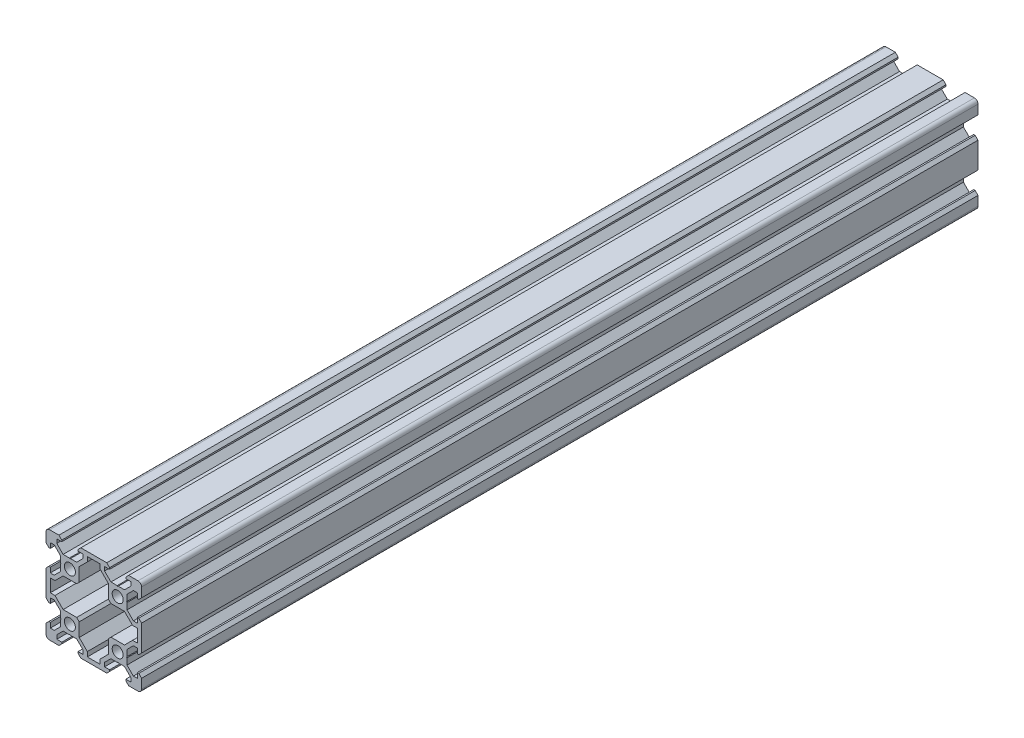
from build123d import *

# Parameters (mm, degrees)
SKETCH1_R           = 2.3
BOSS_EXTRUDE1_DEPTH = 350


with BuildPart() as part:
    # Sketch1 → Boss-Extrude1 (new body)
    with BuildSketch(Plane.XY):
        with BuildLine():
            Line((14.58, -20), (18.5, -20))
            ThreePointArc((18.5, -20), (19.560660172, -19.560660172), (20, -18.5))
            Line((20, -18.5), (20, -14.58))
            Line((20, -14.58), (18.815, -13.395))
            Line((18.815, -13.395), (18.2, -13.395))
            Line((18.2, -13.395), (18.2, -15.5))
            Line((18.2, -15.5), (16.560660172, -15.5))
            Line((16.560660172, -15.5), (13.9, -12.839339828))
            Line((13.9, -12.839339828), (13.9, -10.21))
            Line((13.9, -10.21), (13.69, -10))
            Line((13.69, -10), (13.9, -9.79))
            Line((13.9, -9.79), (13.9, -7.160660172))
            Line((13.9, -7.160660172), (16.560660172, -4.5))
            Line((16.560660172, -4.5), (18.2, -4.5))
            Line((18.2, -4.5), (18.2, -6.605))
            Line((18.2, -6.605), (18.815, -6.605))
            Line((18.815, -6.605), (20, -5.42))
            Line((20, -5.42), (20, 5.42))
            Line((20, 5.42), (18.815, 6.605))
            Line((18.815, 6.605), (18.2, 6.605))
            Line((18.2, 6.605), (18.2, 4.5))
            Line((18.2, 4.5), (16.560660172, 4.5))
            Line((16.560660172, 4.5), (13.9, 7.160660172))
            Line((13.9, 7.160660172), (13.9, 9.79))
            Line((13.9, 9.79), (13.69, 10))
            Line((13.69, 10), (13.9, 10.21))
            Line((13.9, 10.21), (13.9, 12.839339828))
            Line((13.9, 12.839339828), (16.560660172, 15.5))
            Line((16.560660172, 15.5), (18.2, 15.5))
            Line((18.2, 15.5), (18.2, 13.395))
            Line((18.2, 13.395), (18.815, 13.395))
            Line((18.815, 13.395), (20, 14.58))
            Line((20, 14.58), (20, 18.5))
            ThreePointArc((20, 18.5), (19.560660172, 19.560660172), (18.5, 20))
            Line((18.5, 20), (14.58, 20))
            Line((14.58, 20), (13.395, 18.815))
            Line((13.395, 18.815), (13.395, 18.2))
            Line((13.395, 18.2), (15.5, 18.2))
            Line((15.5, 18.2), (15.5, 16.560660172))
            Line((15.5, 16.560660172), (12.839339828, 13.9))
            Line((12.839339828, 13.9), (10.21, 13.9))
            Line((10.21, 13.9), (10, 13.69))
            Line((10, 13.69), (9.79, 13.9))
            Line((9.79, 13.9), (7.160660172, 13.9))
            Line((7.160660172, 13.9), (4.5, 16.560660172))
            Line((4.5, 16.560660172), (4.5, 18.2))
            Line((4.5, 18.2), (6.605, 18.2))
            Line((6.605, 18.2), (6.605, 18.815))
            Line((6.605, 18.815), (5.42, 20))
            Line((5.42, 20), (-5.42, 20))
            Line((-5.42, 20), (-6.605, 18.815))
            Line((-6.605, 18.815), (-6.605, 18.2))
            Line((-6.605, 18.2), (-4.5, 18.2))
            Line((-4.5, 18.2), (-4.5, 16.560660172))
            Line((-4.5, 16.560660172), (-7.160660172, 13.9))
            Line((-7.160660172, 13.9), (-9.79, 13.9))
            Line((-9.79, 13.9), (-10, 13.69))
            Line((-10, 13.69), (-10.21, 13.9))
            Line((-10.21, 13.9), (-12.839339828, 13.9))
            Line((-12.839339828, 13.9), (-15.5, 16.560660172))
            Line((-15.5, 16.560660172), (-15.5, 18.2))
            Line((-15.5, 18.2), (-13.395, 18.2))
            Line((-13.395, 18.2), (-13.395, 18.815))
            Line((-13.395, 18.815), (-14.58, 20))
            Line((-14.58, 20), (-18.5, 20))
            ThreePointArc((-18.5, 20), (-19.560660172, 19.560660172), (-20, 18.5))
            Line((-20, 18.5), (-20, 14.58))
            Line((-20, 14.58), (-18.815, 13.395))
            Line((-18.815, 13.395), (-18.2, 13.395))
            Line((-18.2, 13.395), (-18.2, 15.5))
            Line((-18.2, 15.5), (-16.560660172, 15.5))
            Line((-16.560660172, 15.5), (-13.9, 12.839339828))
            Line((-13.9, 12.839339828), (-13.9, 10.21))
            Line((-13.9, 10.21), (-13.69, 10))
            Line((-13.69, 10), (-13.9, 9.79))
            Line((-13.9, 9.79), (-13.9, 7.160660172))
            Line((-13.9, 7.160660172), (-16.560660172, 4.5))
            Line((-16.560660172, 4.5), (-18.2, 4.5))
            Line((-18.2, 4.5), (-18.2, 6.605))
            Line((-18.2, 6.605), (-18.815, 6.605))
            Line((-18.815, 6.605), (-20, 5.42))
            Line((-20, 5.42), (-20, -5.42))
            Line((-20, -5.42), (-18.815, -6.605))
            Line((-18.815, -6.605), (-18.2, -6.605))
            Line((-18.2, -6.605), (-18.2, -4.5))
            Line((-18.2, -4.5), (-16.560660172, -4.5))
            Line((-16.560660172, -4.5), (-13.9, -7.160660172))
            Line((-13.9, -7.160660172), (-13.9, -9.79))
            Line((-13.9, -9.79), (-13.69, -10))
            Line((-13.69, -10), (-13.9, -10.21))
            Line((-13.9, -10.21), (-13.9, -12.839339828))
            Line((-13.9, -12.839339828), (-16.560660172, -15.5))
            Line((-16.560660172, -15.5), (-18.2, -15.5))
            Line((-18.2, -15.5), (-18.2, -13.395))
            Line((-18.2, -13.395), (-18.815, -13.395))
            Line((-18.815, -13.395), (-20, -14.58))
            Line((-20, -14.58), (-20, -18.5))
            ThreePointArc((-20, -18.5), (-19.560660172, -19.560660172), (-18.5, -20))
            Line((-18.5, -20), (-14.58, -20))
            Line((-14.58, -20), (-13.395, -18.815))
            Line((-13.395, -18.815), (-13.395, -18.2))
            Line((-13.395, -18.2), (-15.5, -18.2))
            Line((-15.5, -18.2), (-15.5, -16.560660172))
            Line((-15.5, -16.560660172), (-12.839339828, -13.9))
            Line((-12.839339828, -13.9), (-10.21, -13.9))
            Line((-10.21, -13.9), (-10, -13.69))
            Line((-10, -13.69), (-9.79, -13.9))
            Line((-9.79, -13.9), (-7.160660172, -13.9))
            Line((-7.160660172, -13.9), (-4.5, -16.560660172))
            Line((-4.5, -16.560660172), (-4.5, -18.2))
            Line((-4.5, -18.2), (-6.605, -18.2))
            Line((-6.605, -18.2), (-6.605, -18.815))
            Line((-6.605, -18.815), (-5.42, -20))
            Line((-5.42, -20), (5.42, -20))
            Line((5.42, -20), (6.605, -18.815))
            Line((6.605, -18.815), (6.605, -18.2))
            Line((6.605, -18.2), (4.5, -18.2))
            Line((4.5, -18.2), (4.5, -16.560660172))
            Line((4.5, -16.560660172), (7.160660172, -13.9))
            Line((7.160660172, -13.9), (9.79, -13.9))
            Line((9.79, -13.9), (10, -13.69))
            Line((10, -13.69), (10.21, -13.9))
            Line((10.21, -13.9), (12.839339828, -13.9))
            Line((12.839339828, -13.9), (15.5, -16.560660172))
            Line((15.5, -16.560660172), (15.5, -18.2))
            Line((15.5, -18.2), (13.395, -18.2))
            Line((13.395, -18.2), (13.395, -18.815))
            Line((13.395, -18.815), (14.58, -20))
        make_face()
        with Locations((-10, -10)):
            Circle(SKETCH1_R, mode=Mode.SUBTRACT)
        with Locations((10, -10)):
            Circle(SKETCH1_R, mode=Mode.SUBTRACT)
        Polygon((-16.239339828, -2.7), (-18.2, -2.7), (-18.2, 2.7), (-16.239339828, 2.7), (-12.839339828, 6.1), (-7.160660172, 6.1), (-6.1, 7.160660172), (-6.1, 12.839339828), (-2.7, 16.239339828), (-2.7, 18.2), (2.7, 18.2), (2.7, 16.239339828), (6.1, 12.839339828), (6.1, 7.160660172), (7.160660172, 6.1), (12.839339828, 6.1), (16.239339828, 2.7), (18.2, 2.7), (18.2, -2.7), (16.239339828, -2.7), (12.839339828, -6.1), (7.160660172, -6.1), (6.1, -7.160660172), (6.1, -12.839339828), (2.7, -16.239339828), (2.7, -18.2), (-2.7, -18.2), (-2.7, -16.239339828), (-6.1, -12.839339828), (-6.1, -7.160660172), (-7.160660172, -6.1), (-12.839339828, -6.1), align=None, mode=Mode.SUBTRACT)
        with Locations((-10, 10)):
            Circle(SKETCH1_R, mode=Mode.SUBTRACT)
        with Locations((10, 10)):
            Circle(SKETCH1_R, mode=Mode.SUBTRACT)
    extrude(amount=BOSS_EXTRUDE1_DEPTH)


solid = part.part
